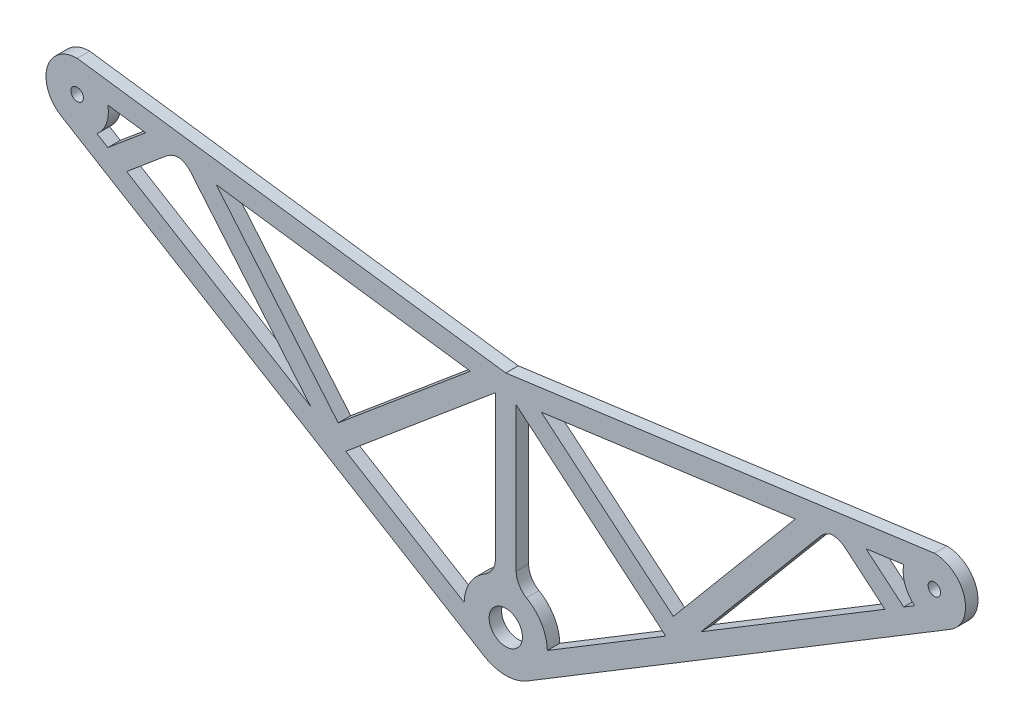
from build123d import *

# Parameters (mm, degrees)
SKETCH_1_R      = 4
SKETCH_1_R_2    = 1.5
EXTRUDE_1_DEPTH = 3
FILLET_1_R      = 5
FILLET_2_R      = 5
FILLET_3_R      = 5


with BuildPart() as part:
    # 草图1 → 凸台-拉伸1 (new body)
    with BuildSketch(Plane.XY):
        with BuildLine():
            Line((101.056239558, 66.72819932), (0, 53))
            Line((0, 53), (-101.056239558, 66.72819932))
            Line((-101.056239558, 66.72819932), (-103.05702305, 67))
            ThreePointArc((-103.05702305, 67), (-110.280675742, 61.517137029), (-106.942649005, 53.085024478))
            Line((-106.942649005, 53.085024478), (-5.180834606, -8.553300696))
            ThreePointArc((-5.180834606, -8.553300696), (-3.881694774, -9.215880082), (-2.5, -9.682458366))
            ThreePointArc((-2.5, -9.682458366), (0, -10), (2.5, -9.682458366))
            ThreePointArc((2.5, -9.682458366), (3.881694774, -9.215880082), (5.180834606, -8.553300696))
            Line((5.180834606, -8.553300696), (106.942649005, 53.085024478))
            ThreePointArc((106.942649005, 53.085024478), (110.280675742, 61.517137029), (103.05702305, 67))
            Line((103.05702305, 67), (101.056239558, 66.72819932))
        make_face()
        Circle(SKETCH_1_R, mode=Mode.SUBTRACT)
        with BuildLine():
            Line((-38.470197272, 17.456153435), (-2.5, 47.638732699))
            Line((-2.5, 47.638732699), (-2.5, 9.682458366))
            ThreePointArc((-2.5, 9.682458366), (-7.840929555, 6.206434058), (-9.997792991, 0.210084034))
            Line((-9.997792991, 0.210084034), (-38.470197272, 17.456153435))
        make_face(mode=Mode.SUBTRACT)
        with BuildLine():
            Line((38.470197272, 17.456153435), (9.997792991, 0.210084034))
            ThreePointArc((9.997792991, 0.210084034), (7.840929555, 6.206434058), (2.5, 9.682458366))
            Line((2.5, 9.682458366), (2.5, 47.638732699))
            Line((2.5, 47.638732699), (38.470197272, 17.456153435))
        make_face(mode=Mode.SUBTRACT)
        Polygon((-76.992375251, 58.413267417), (-46.919815599, 22.574186413), (-91.163166243, 49.372903102), (-79.915961764, 58.810428231), align=None, mode=Mode.SUBTRACT)
        Polygon((-69.625606174, 57.412513038), (-8.52297152, 49.111895964), (-40.292213402, 22.454336819), align=None, mode=Mode.SUBTRACT)
        with BuildLine():
            Line((-95.680736217, 52.109248249), (-98.304134778, 53.698271544))
            ThreePointArc((-98.304134778, 53.698271544), (-95.998027486, 56.966113336), (-95.699425849, 60.954566405))
            Line((-95.699425849, 60.954566405), (-86.610723734, 59.719892378))
            Line((-86.610723734, 59.719892378), (-95.680736217, 52.109248249))
        make_face(mode=Mode.SUBTRACT)
        with Locations((-103.05702305, 59.5)):
            Circle(SKETCH_1_R_2, mode=Mode.SUBTRACT)
        Polygon((40.292213402, 22.454336819), (8.52297152, 49.111895964), (69.625606174, 57.412513038), align=None, mode=Mode.SUBTRACT)
        Polygon((91.163166243, 49.372903102), (46.919815599, 22.574186413), (76.992375251, 58.413267417), (79.915961764, 58.810428231), align=None, mode=Mode.SUBTRACT)
        with BuildLine():
            Line((95.680736217, 52.109248249), (86.610723734, 59.719892378))
            Line((86.610723734, 59.719892378), (95.699425849, 60.954566405))
            ThreePointArc((95.699425849, 60.954566405), (95.998027486, 56.966113336), (98.304134778, 53.698271544))
            Line((98.304134778, 53.698271544), (95.680736217, 52.109248249))
        make_face(mode=Mode.SUBTRACT)
        with Locations((103.05702305, 59.5)):
            Circle(SKETCH_1_R_2, mode=Mode.SUBTRACT)
    extrude(amount=EXTRUDE_1_DEPTH)

    # 圆角1
    # the kernel refuses this fillet: 5 mm, written as the material it adds along each edge
    with BuildSketch(Plane(origin=(76.992375251, 58.413267417, 0), x_dir=(0.9908985592379703, 0.1346107176272178, 0), z_dir=(0, 0, 1))) as fillet_1_piece_1:
        with BuildLine():
            CenterArc((FILLET_1_R * 0.386508582556, -FILLET_1_R), FILLET_1_R, 90, 42.263889815)
            Line((-FILLET_1_R * 0.286037651021, -FILLET_1_R * 0.259944891443), (0, 0))
            Line((0, 0), (FILLET_1_R * 0.386508582556, 0))
        make_face()
    extrude(amount=3)
    with BuildSketch(Plane(origin=(79.915961764, 58.810428231, 0), x_dir=(0.7660444431189772, -0.6427876096865403, 0), z_dir=(0, 0, 1))) as fillet_1_piece_2:
        with BuildLine():
            CenterArc((FILLET_1_R * 0.442472138408, -FILLET_1_R), FILLET_1_R, 90, 47.736110185)
            Line((-FILLET_1_R * 0.297582970149, -FILLET_1_R * 0.327453766423), (0, 0))
            Line((0, 0), (FILLET_1_R * 0.442472138408, 0))
        make_face()
    extrude(amount=3)

    # 圆角2
    # the kernel refuses this fillet: 5 mm, written as the material it adds along each edge
    with BuildSketch(Plane(origin=(-79.915961764, 58.810428231, 0), x_dir=(0.9908985592379704, -0.13461071762721746, 0), z_dir=(0, 0, 1))) as fillet_2_piece_1:
        with BuildLine():
            CenterArc((FILLET_2_R * 0.442472138408, -FILLET_2_R), FILLET_2_R, 90, 47.736110185)
            Line((-FILLET_2_R * 0.297582970149, -FILLET_2_R * 0.327453766423), (0, 0))
            Line((0, 0), (FILLET_2_R * 0.442472138408, 0))
        make_face()
    extrude(amount=3)
    with BuildSketch(Plane(origin=(-76.992375251, 58.413267417, 0), x_dir=(0.642787609686538, -0.7660444431189791, 0), z_dir=(0, 0, 1))) as fillet_2_piece_2:
        with BuildLine():
            CenterArc((FILLET_2_R * 0.386508582556, -FILLET_2_R), FILLET_2_R, 90, 42.263889815)
            Line((-FILLET_2_R * 0.286037651021, -FILLET_2_R * 0.259944891443), (0, 0))
            Line((0, 0), (FILLET_2_R * 0.386508582556, 0))
        make_face()
    extrude(amount=3)

    # 圆角3
    fillet_3_edges = [part.edges().sort_by_distance(p)[0] for p in [
        (-2.5, 9.682458366, 1.5),
        (2.5, 9.682458366, 1.5),
    ]]
    fillet(fillet_3_edges, radius=FILLET_3_R)


solid = part.part
